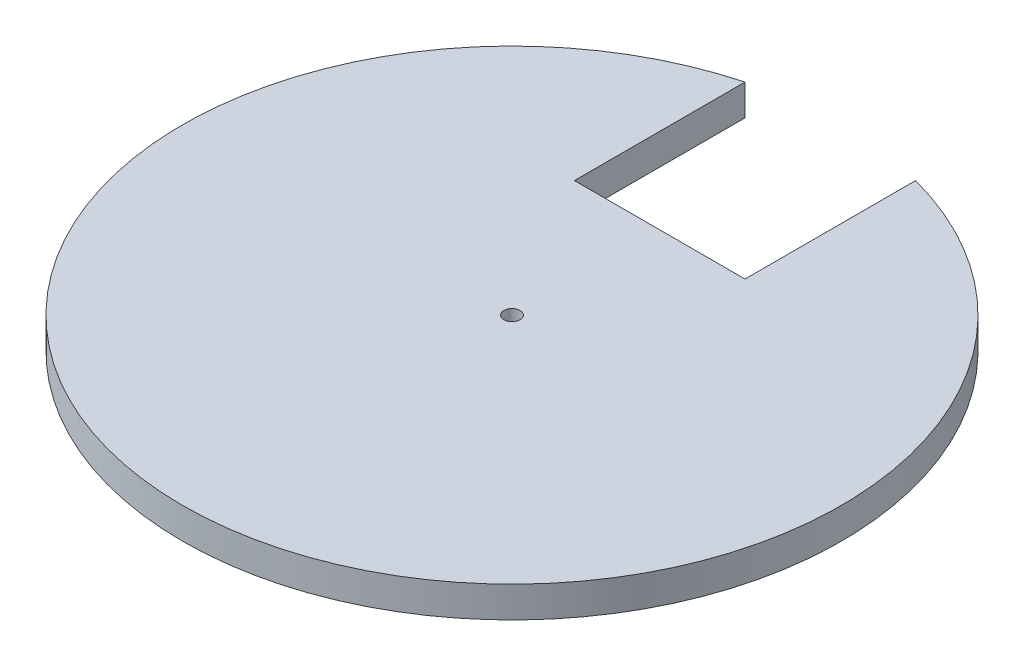
from build123d import *

# Parameters (mm, degrees)
BOSS_EXTRUDE1_DEPTH = 10
SKETCH3_R           = 2.6
CUT_EXTRUDE1_DEPTH  = 10


with BuildPart() as part:
    # Sketch2 → Boss-Extrude1 (new body)
    with BuildSketch(Plane(origin=(0, 0, 0), x_dir=(1, 0, 0), z_dir=(0, 1, 0))):
        with BuildLine():
            Line((0, 0), (55, 0))
            Line((55, 0), (55, 55))
            ThreePointArc((55, 55), (27.5, -153.8832381), (0, 55))
            Line((0, 55), (0, 0))
        make_face()
    extrude(amount=BOSS_EXTRUDE1_DEPTH)

    # Sketch3 → Cut-Extrude1 (cut)
    with BuildSketch(Plane(origin=(0, 10, 0), x_dir=(1, 0, 0), z_dir=(0, 1, 0))):
        with Locations((27.5, -47.631397208)):
            Circle(SKETCH3_R)
    extrude(amount=-CUT_EXTRUDE1_DEPTH, mode=Mode.SUBTRACT)


solid = part.part
